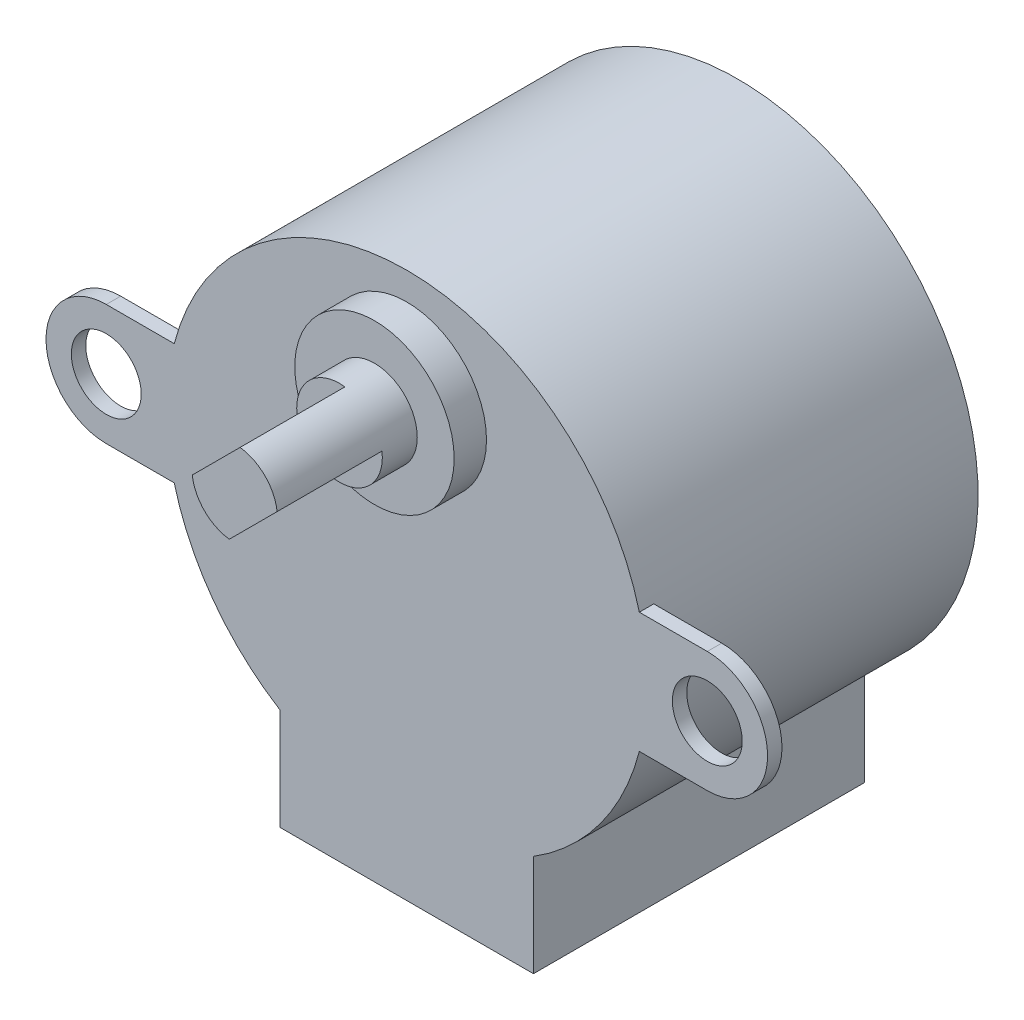
from build123d import *

# Parameters (mm, degrees)
BOSS_EXTRUDE1_DEPTH = 19.2532
BOSS_EXTRUDE2_START = -0.8382
SKETCH2_R           = 2.032
BOSS_EXTRUDE2_DEPTH = 0.8382
SKETCH3_R           = 4.6355
BOSS_EXTRUDE3_DEPTH = 1.8796
SKETCH4_R           = 2.4892
BOSS_EXTRUDE4_DEPTH = 8.128
CUT_EXTRUDE1_START  = -6.096
CUT_EXTRUDE1_DEPTH  = 6.096


with BuildPart() as part:
    # Sketch1 → Boss-Extrude1 (new body)
    with BuildSketch(Plane.XY):
        with BuildLine():
            Line((-7.366, -17.78), (7.366, -17.78))
            Line((7.366, -17.78), (7.366, -11.870254589))
            ThreePointArc((7.366, -11.870254589), (0, 13.97), (-7.366, -11.870254589))
            Line((-7.366, -11.870254589), (-7.366, -17.78))
        make_face()
    extrude(amount=BOSS_EXTRUDE1_DEPTH)

    # Sketch2 → Boss-Extrude2 (add)
    # profile 1 of 2: a face of its own
    with BuildSketch(Plane.XY.offset(19.2532).offset(BOSS_EXTRUDE2_START)):
        with BuildLine():
            Line((-13.52310885, -3.5052), (-17.4752, -3.5052))
            ThreePointArc((-17.4752, -3.5052), (-20.9804, 0), (-17.4752, 3.5052))
            Line((-17.4752, 3.5052), (-13.52310885, 3.5052))
            ThreePointArc((-13.52310885, 3.5052), (-13.97, 0), (-13.52310885, -3.5052))
        make_face()
        with Locations((-17.4752, 0)):
            Circle(SKETCH2_R, mode=Mode.SUBTRACT)
    # profile 2 of 2: a face of its own
    with BuildSketch(Plane.XY.offset(19.2532).offset(BOSS_EXTRUDE2_START)):
        with BuildLine():
            Line((13.52310885, 3.5052), (17.4752, 3.5052))
            ThreePointArc((17.4752, 3.5052), (20.9804, 0), (17.4752, -3.5052))
            Line((17.4752, -3.5052), (13.52310885, -3.5052))
            ThreePointArc((13.52310885, -3.5052), (13.97, 0), (13.52310885, 3.5052))
        make_face()
        with Locations((17.4752, 0)):
            Circle(SKETCH2_R, mode=Mode.SUBTRACT)
    extrude(amount=BOSS_EXTRUDE2_DEPTH)

    # Sketch3 → Boss-Extrude3 (add)
    with BuildSketch(Plane.XY.offset(19.2532)):
        with Locations((0, 7.7343)):
            Circle(SKETCH3_R)
    extrude(amount=BOSS_EXTRUDE3_DEPTH)

    # Sketch4 → Boss-Extrude4 (add)
    with BuildSketch(Plane.XY.offset(21.1328)):
        with Locations((0, 7.7343)):
            Circle(SKETCH4_R)
    extrude(amount=BOSS_EXTRUDE4_DEPTH)

    # Sketch5 → Cut-Extrude1 (cut)
    with BuildSketch(Plane.XY.offset(29.2608).offset(CUT_EXTRUDE1_START)):
        with BuildLine():
            Line((2.469309692, 8.048348223), (-0.314048223, 5.264990308))
            ThreePointArc((-0.314048223, 5.264990308), (1.7601302, 5.9741698), (2.469309692, 8.048348223))
        make_face()
        with BuildLine():
            Line((0.314048223, 10.203609692), (-2.469309692, 7.420251777))
            ThreePointArc((-2.469309692, 7.420251777), (-1.7601302, 9.4944302), (0.314048223, 10.203609692))
        make_face()
    extrude(amount=CUT_EXTRUDE1_DEPTH, mode=Mode.SUBTRACT)


solid = part.part
